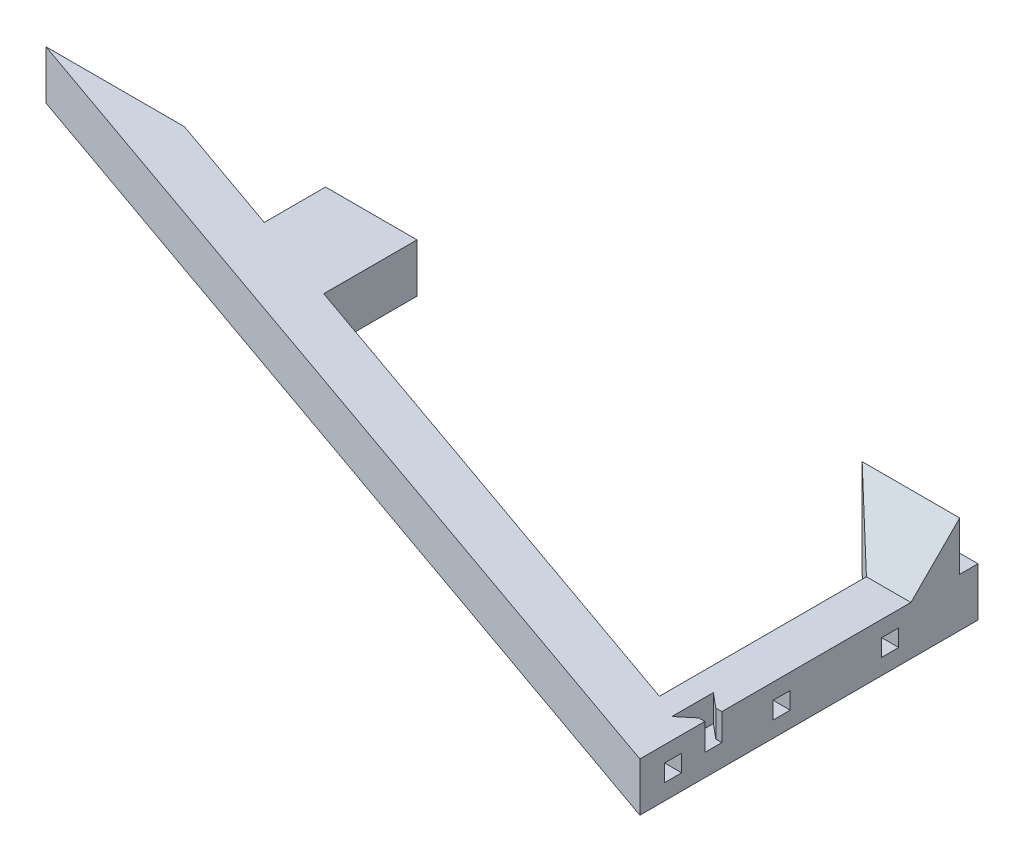
from build123d import *

# Parameters (mm, degrees)
P_IDAT_VYSUNUT_M1_DEPTH  = 8
ODEBRAT_VYSUNUT_M1_DEPTH = 4.4
P_IDAT_START             = 8
SKICA5_W                 = 16
SKICA5_H                 = 8
P_IDAT_VYSUNUT_M2_DEPTH  = 16
ODEBRAT_VYSUNUT_M3_DEPTH = 161.57934176
ODEBRAT_VYSUNUT_M4_DEPTH = 161.57934176
SKICA4_W                 = 2.8
SKICA4_H                 = 2.8
ODEBRAT_VYSUNUT_M2_DEPTH = 4.4


with BuildPart() as part:
    # Skica2 → Přidat vysunutím1 (new body)
    with BuildSketch(Plane(origin=(0, 0, 0), x_dir=(1, 0, 0), z_dir=(0, 1, 0))):
        Polygon((0, 0), (0, -55.45), (-149.85, -3), (-127.147799643, -3), (-107, -10.052066008), (-107, 0), (-92, 0), (-92, -15.302316258), (-7.3, -44.948729338), (-7.3, 0), align=None)
    extrude(amount=P_IDAT_VYSUNUT_M1_DEPTH)

    # Skica3 → Odebrat vysunutím1 (cut)
    with BuildSketch(Plane(origin=(0, 8, 0), x_dir=(1, 0, 0), z_dir=(0, 1, 0))):
        Polygon((0, -42), (-1, -42), (-3.4, -40), (-3.4, -46.8), (-1, -44.8), (0, -44.8), align=None)
    extrude(amount=-ODEBRAT_VYSUNUT_M1_DEPTH, mode=Mode.SUBTRACT)

    # Skica5 → Přidat vysunutím2 (add)
    with BuildSketch(Plane(origin=(0, 8, 0), x_dir=(1, 0, 0), z_dir=(0, 1, 0)).offset(P_IDAT_START)):
        with Locations((-8, -7)):
            Rectangle(SKICA5_W, SKICA5_H)
    extrude(amount=-P_IDAT_VYSUNUT_M2_DEPTH)

    # Skica6 → Odebrat vysunutím3 (cut, through all)
    with BuildSketch(Plane(origin=(0, 0, 0), x_dir=(0, 0, -1), z_dir=(1, 0, 0))):
        Polygon((-11, 8), (-11, 16), (-3, 16), align=None)
    extrude(amount=-ODEBRAT_VYSUNUT_M3_DEPTH, mode=Mode.SUBTRACT)

    # Skica7 → Odebrat vysunutím4 (cut, through all)
    with BuildSketch(Plane.XZ):
        Polygon((-16, 3), (-16, 11), (-7.3, 11), align=None)
    extrude(amount=-ODEBRAT_VYSUNUT_M4_DEPTH, mode=Mode.SUBTRACT)

    # Skica4 → Odebrat vysunutím2 (cut)
    with BuildSketch(Plane(origin=(0, 0, 0), x_dir=(0, 0, -1), z_dir=(1, 0, 0))):
        with Locations((-50, 4)):
            Rectangle(SKICA4_W, SKICA4_H)
        with Locations((-32.2, 4)):
            Rectangle(SKICA4_W, SKICA4_H)
        with Locations((-14.4, 4)):
            Rectangle(SKICA4_W, SKICA4_H)
    extrude(amount=-ODEBRAT_VYSUNUT_M2_DEPTH, mode=Mode.SUBTRACT)


solid = part.part
